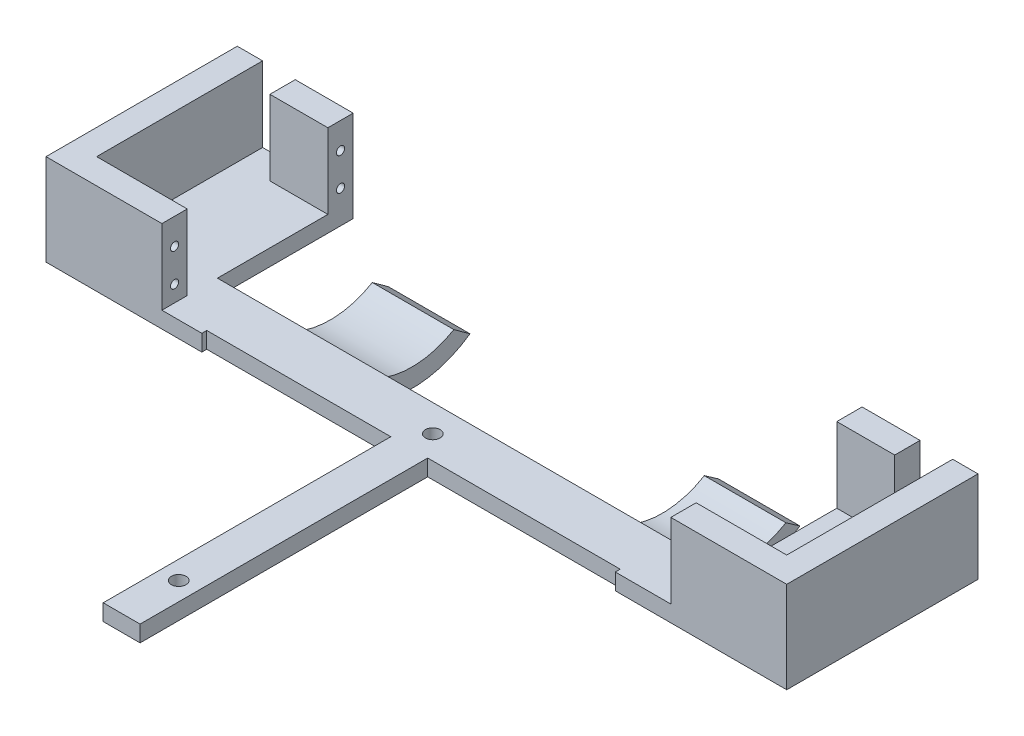
from build123d import *

# Parameters (mm, degrees)
BOSS_EXTRUDE1_DEPTH  = 5
SKETCH6_W            = 1.81
SKETCH6_H            = 7.76
SKETCH6_W_2          = 18.76
BOSS_EXTRUDE2_DEPTH  = 28
BOSS_EXTRUDE3_REACH  = 259.198
SKETCH7_W            = 7.76
SKETCH7_H            = 5
SKETCH9_W            = 27.76
SKETCH9_H            = 5
BOSS_EXTRUDE4_DEPTH  = 58.62
BOSS_EXTRUDE5_REACH  = 189.418
SKETCH10_W           = 27.76
SKETCH10_H           = 7.76
SKETCH11_W           = 58.62
SKETCH11_H           = 33
BOSS_EXTRUDE6_DEPTH  = 7.76
SKETCH12_R           = 2.25
CUT_EXTRUDE1_DEPTH   = 188.418175479
SKETCH13_W           = 1.81
SKETCH13_H           = 7.76
SKETCH13_W_2         = 18.76
BOSS_EXTRUDE7_DEPTH  = 28
BOSS_EXTRUDE8_REACH  = 265.563
SKETCH14_W           = 7.76
SKETCH14_H           = 5
SKETCH15_W           = 27.76
SKETCH15_H           = 5
BOSS_EXTRUDE9_DEPTH  = 50.86
BOSS_EXTRUDE10_REACH = 189.418
SKETCH16_W           = 27.76
SKETCH16_H           = 7.76
SKETCH17_W           = 58.62
SKETCH17_H           = 33
BOSS_EXTRUDE11_DEPTH = 7.76
CUT_EXTRUDE4_REACH   = 195.072
SKETCH23_W           = 35.52
SKETCH23_H           = 5
CUT_EXTRUDE5_REACH   = 195.072
SKETCH24_W           = 35.52
SKETCH24_H           = 5
SKETCH25_W           = 7.76
SKETCH25_H           = 23
CUT_EXTRUDE6_DEPTH   = 1.81
SKETCH26_W           = 7.76
SKETCH26_H           = 23
CUT_EXTRUDE7_DEPTH   = 1.81
SKETCH27_R           = 1.25
CUT_EXTRUDE8_DEPTH   = 5
CUT_EXTRUDE9_START   = -5
SKETCH28_R           = 1.25
CUT_EXTRUDE9_DEPTH   = 5
BOSS_EXTRUDE14_DEPTH = 25
SKETCH30_W           = 7.667684365
SKETCH30_H           = 9.552630881
CUT_EXTRUDE13_DEPTH  = 30
FILLET2_R            = 15
CUT_EXTRUDE14_REACH  = 193.616
SKETCH31_W           = 5
SKETCH31_H           = 41.6
FILLET6_R            = 21
BOSS_EXTRUDE15_DEPTH = 25
FILLET7_R            = 15
FILLET8_R            = 20
SKETCH37_W           = 7.377214054
SKETCH37_H           = 9
CUT_EXTRUDE16_DEPTH  = 25
CUT_EXTRUDE17_REACH  = 194.28
SKETCH38_W           = 1
SKETCH38_H           = 23
SKETCH39_W           = 12.24
SKETCH39_H           = 5
SKETCH39_W_2         = 12.01
CUT_EXTRUDE19_DEPTH  = 41.6


with BuildPart() as part:
    # Sketch5 → Boss-Extrude1 (new body)
    with BuildSketch(Plane(origin=(0, 0, 0), x_dir=(1, 0, 0), z_dir=(0, 1, 0))):
        Polygon((0, 0), (0, 88.14), (-56.41, 88.14), (-56.41, 86.64), (-96.41, 86.64), (-96.41, 145.26), (-56.41, 145.26), (-56.41, 103.66), (9.075, 103.66), (70.3, 103.66), (70.3, 145.26), (115.07, 145.26), (115.07, 86.64), (70.3, 86.64), (70.3, 88.14), (11.3, 88.14), (11.3, 0), align=None)
    extrude(amount=BOSS_EXTRUDE1_DEPTH)

    # Sketch6 → Boss-Extrude2 (add)
    with BuildSketch(Plane(origin=(0, 5, 0), x_dir=(1, 0, 0), z_dir=(0, 1, 0))):
        with Locations((-95.505, 141.38)):
            Rectangle(SKETCH6_W, SKETCH6_H)
        with Locations((-78.03, 141.38)):
            Rectangle(SKETCH6_W_2, SKETCH6_H)
    extrude(amount=BOSS_EXTRUDE2_DEPTH)

    # Sketch7 → Boss-Extrude3 (add, up to next)
    with BuildSketch(Plane(origin=(-94.6, 0, 0), x_dir=(0, 0, -1), z_dir=(1, 0, 0)), mode=Mode.PRIVATE) as boss_extrude3_sk1:
        with Locations((141.38, 30.5)):
            Rectangle(SKETCH7_W, SKETCH7_H)
    boss_extrude3_tool1 = extrude(boss_extrude3_sk1.sketch, amount=BOSS_EXTRUDE3_REACH, mode=Mode.PRIVATE) - part.part
    add(boss_extrude3_tool1.solids().sort_by_distance((-94.6, 30.5, -141.38))[0])

    # Sketch9 → Boss-Extrude4 (add)
    with BuildSketch(Plane(origin=(0, 0, -145.26), x_dir=(-1, 0, 0), z_dir=(0, 0, -1))):
        with Locations((82.53, 30.5)):
            Rectangle(SKETCH9_W, SKETCH9_H)
    extrude(amount=-BOSS_EXTRUDE4_DEPTH)

    # Sketch10 → Boss-Extrude5 (add, up to next)
    with BuildSketch(Plane.XZ.offset(-28), mode=Mode.PRIVATE) as boss_extrude5_sk1:
        with Locations((-82.53, -90.52)):
            Rectangle(SKETCH10_W, SKETCH10_H)
    boss_extrude5_tool1 = extrude(boss_extrude5_sk1.sketch, amount=BOSS_EXTRUDE5_REACH, mode=Mode.PRIVATE) - part.part
    add(boss_extrude5_tool1.solids().sort_by_distance((-82.53, 28, -90.52))[0])

    # Sketch11 → Boss-Extrude6 (add)
    with BuildSketch(Plane.ZY.offset(96.41)):
        with Locations((-115.95, 16.5)):
            Rectangle(SKETCH11_W, SKETCH11_H)
    extrude(amount=BOSS_EXTRUDE6_DEPTH)

    # Sketch12 → Cut-Extrude1 (cut, through all)
    with BuildSketch(Plane(origin=(0, 5, 0), x_dir=(1, 0, 0), z_dir=(0, 1, 0))):
        with Locations(Location((5.65, 17.48, 0), (0, 0, 270))):
            Circle(SKETCH12_R)
        with Locations(Location((5.65, 95.35, 0), (0, 0, 270))):
            Circle(SKETCH12_R)
    extrude(amount=-CUT_EXTRUDE1_DEPTH, mode=Mode.SUBTRACT)

    # Sketch13 → Boss-Extrude7 (add)
    with BuildSketch(Plane(origin=(0, 5, 0), x_dir=(1, 0, 0), z_dir=(0, 1, 0))):
        with Locations((114.165, 141.38)):
            Rectangle(SKETCH13_W, SKETCH13_H)
        with Locations((96.69, 141.38)):
            Rectangle(SKETCH13_W_2, SKETCH13_H)
    extrude(amount=BOSS_EXTRUDE7_DEPTH)

    # Sketch14 → Boss-Extrude8 (add, up to next)
    with BuildSketch(Plane.ZY.offset(-113.26), mode=Mode.PRIVATE) as boss_extrude8_sk1:
        with Locations((-141.38, 30.5)):
            Rectangle(SKETCH14_W, SKETCH14_H)
    boss_extrude8_tool1 = extrude(boss_extrude8_sk1.sketch, amount=BOSS_EXTRUDE8_REACH, mode=Mode.PRIVATE) - part.part
    add(boss_extrude8_tool1.solids().sort_by_distance((113.26, 30.5, -141.38))[0])

    # Sketch15 → Boss-Extrude9 (add)
    with BuildSketch(Plane.XY.offset(-137.5)):
        with Locations((101.19, 30.5)):
            Rectangle(SKETCH15_W, SKETCH15_H)
    extrude(amount=BOSS_EXTRUDE9_DEPTH)

    # Sketch16 → Boss-Extrude10 (add, up to next)
    with BuildSketch(Plane.XZ.offset(-28), mode=Mode.PRIVATE) as boss_extrude10_sk1:
        with Locations((101.19, -90.52)):
            Rectangle(SKETCH16_W, SKETCH16_H)
    boss_extrude10_tool1 = extrude(boss_extrude10_sk1.sketch, amount=BOSS_EXTRUDE10_REACH, mode=Mode.PRIVATE) - part.part
    add(boss_extrude10_tool1.solids().sort_by_distance((101.19, 28, -90.52))[0])

    # Sketch17 → Boss-Extrude11 (add)
    with BuildSketch(Plane(origin=(115.07, 0, 0), x_dir=(0, 0, -1), z_dir=(1, 0, 0))):
        with Locations((115.95, 16.5)):
            Rectangle(SKETCH17_W, SKETCH17_H)
    extrude(amount=BOSS_EXTRUDE11_DEPTH)

    # Sketch23 → Cut-Extrude4 (cut, up to next)
    with BuildSketch(Plane(origin=(0, 0, -145.26), x_dir=(-1, 0, 0), z_dir=(0, 0, -1)), mode=Mode.PRIVATE) as cut_extrude4_sk1:
        with Locations((-105.07, 30.5)):
            Rectangle(SKETCH23_W, SKETCH23_H)
    cut_extrude4_tool1 = extrude(cut_extrude4_sk1.sketch, amount=-CUT_EXTRUDE4_REACH, mode=Mode.PRIVATE) & part.part
    add(cut_extrude4_tool1.solids().sort_by_distance((105.07, 30.5, -145.26))[0], mode=Mode.SUBTRACT)

    # Sketch24 → Cut-Extrude5 (cut, up to next)
    with BuildSketch(Plane(origin=(0, 0, -145.26), x_dir=(-1, 0, 0), z_dir=(0, 0, -1)), mode=Mode.PRIVATE) as cut_extrude5_sk1:
        with Locations((86.41, 30.5)):
            Rectangle(SKETCH24_W, SKETCH24_H)
    cut_extrude5_tool1 = extrude(cut_extrude5_sk1.sketch, amount=-CUT_EXTRUDE5_REACH, mode=Mode.PRIVATE) & part.part
    add(cut_extrude5_tool1.solids().sort_by_distance((-86.41, 30.5, -145.26))[0], mode=Mode.SUBTRACT)

    # Sketch25 → Cut-Extrude6 (cut)
    with BuildSketch(Plane(origin=(-94.6, 0, 0), x_dir=(0, 0, -1), z_dir=(1, 0, 0))):
        with Locations((141.38, 16.5)):
            Rectangle(SKETCH25_W, SKETCH25_H)
    extrude(amount=-CUT_EXTRUDE6_DEPTH, mode=Mode.SUBTRACT)

    # Sketch26 → Cut-Extrude7 (cut)
    with BuildSketch(Plane.ZY.offset(-113.26)):
        with Locations((-141.38, 16.5)):
            Rectangle(SKETCH26_W, SKETCH26_H)
    extrude(amount=-CUT_EXTRUDE7_DEPTH, mode=Mode.SUBTRACT)

    # Sketch27 → Cut-Extrude8 (cut)
    with BuildSketch(Plane(origin=(-68.65, 0, 0), x_dir=(0, 0, -1), z_dir=(1, 0, 0))):
        with Locations((141.38, 10)):
            Circle(SKETCH27_R)
        with Locations((141.38, 20)):
            Circle(SKETCH27_R)
        with Locations((90.52, 10)):
            Circle(SKETCH27_R)
        with Locations((90.52, 20)):
            Circle(SKETCH27_R)
    extrude(amount=-CUT_EXTRUDE8_DEPTH, mode=Mode.SUBTRACT)

    # Sketch28 → Cut-Extrude9 (cut)
    with BuildSketch(Plane.ZY.offset(-87.31).offset(CUT_EXTRUDE9_START)):
        with Locations(Location((-90.52, 10, 0), (0, 0, 180))):
            Circle(SKETCH28_R)
        with Locations(Location((-90.52, 20, 0), (0, 0, 180))):
            Circle(SKETCH28_R)
        with Locations(Location((-141.38, 10, 0), (0, 0, 180))):
            Circle(SKETCH28_R)
        with Locations(Location((-141.38, 20, 0), (0, 0, 180))):
            Circle(SKETCH28_R)
    extrude(amount=CUT_EXTRUDE9_DEPTH, mode=Mode.SUBTRACT)

    # Sketch29 → Boss-Extrude14 (add)
    with BuildSketch(Plane.ZY.offset(-70.3)):
        with BuildLine():
            Line((-100.885806154, 13.5), (-96.02, 13.5))
            ThreePointArc((-96.02, 13.5), (-112.167541603, -13.110324995), (-143.227293091, -11.074561329))
            Line((-143.227293091, -11.074561329), (-138.921656543, -8.070233163))
            ThreePointArc((-138.921656543, -8.070233163), (-113.621311283, -8.363216103), (-100.885806154, 13.5))
        make_face()
    extrude(amount=BOSS_EXTRUDE14_DEPTH)

    # Sketch30 → Cut-Extrude13 (cut)
    with BuildSketch(Plane.ZY.offset(-45.3)):
        with Locations((-98.532876856, 9.77631544)):
            Rectangle(SKETCH30_W, SKETCH30_H)
    extrude(amount=-CUT_EXTRUDE13_DEPTH, mode=Mode.SUBTRACT)

    # Fillet2
    # the kernel refuses this fillet: 15 mm, written as the material it adds along each edge
    with BuildSketch(Plane(origin=(45.3, 2.021406869, -103.66), x_dir=(0, 1, 0), z_dir=(1, 0, 0))) as fillet2_piece_1:
        with BuildLine():
            CenterArc((4.606944532, -14.911353785), FILLET2_R, 96.232125796, 36.460543552)
            Line((-5.564040014, -3.886333451), (-5.767459705, -3.665833045))
            ThreePointArc((-5.767459705, -3.665833045), (-3.085586749, -1.508552064), (-0.137007694, 0.266887414))
            Line((-0.137007694, 0.266887414), (0, 0.3))
            ThreePointArc((0, 0.3), (1.489296566, 0.3), (2.946026103, 0.298227076))
            Line((2.946026103, 0.298227076), (2.978593131, 0))
        make_face()
    extrude(amount=25)

    # Sketch31 → Cut-Extrude14 (cut, up to next)
    with BuildSketch(Plane(origin=(0, 5, 0), x_dir=(1, 0, 0), z_dir=(0, 1, 0)), mode=Mode.PRIVATE) as cut_extrude14_sk1:
        with Locations((72.8, 124.46)):
            Rectangle(SKETCH31_W, SKETCH31_H)
    cut_extrude14_tool1 = extrude(cut_extrude14_sk1.sketch, amount=-CUT_EXTRUDE14_REACH, mode=Mode.PRIVATE) & part.part
    add(cut_extrude14_tool1.solids().sort_by_distance((72.8, 5, -124.46))[0], mode=Mode.SUBTRACT)

    # Fillet6
    fillet6_edges = [part.edges().sort_by_distance(p)[0] for p in [
        (57.8, 0, -99.229143351),
    ]]
    fillet(fillet6_edges, radius=FILLET6_R)

    # Sketch35 → Boss-Extrude15 (add)
    with BuildSketch(Plane(origin=(-56.41, 0, 0), x_dir=(0, 0, -1), z_dir=(1, 0, 0))):
        with BuildLine():
            Line((100.859945263, 14), (95.147502284, 14))
            ThreePointArc((95.147502284, 14), (111.813431349, -13.409569906), (143.817650668, -11.226072741))
            Line((143.817650668, -11.226072741), (138.864061969, -7.634657993))
            ThreePointArc((138.864061969, -7.634657993), (113.572690006, -7.865333939), (100.859945263, 14))
        make_face()
    extrude(amount=BOSS_EXTRUDE15_DEPTH)

    # Fillet7
    # the kernel refuses this fillet: 15 mm, written as the material it adds along each edge
    with BuildSketch(Plane(origin=(-31.41, 2.464890362, -103.66), x_dir=(0, -0.8213043286229281, -0.5704903152422844), z_dir=(-1, 0, 0))) as fillet7_piece_1:
        with BuildLine():
            CenterArc((4.607787404, -14.871807742), FILLET7_R, 82.503946448, 33.982894416)
            Line((-2.082096519, -1.446255497), (-2.215894198, -1.177744452))
            ThreePointArc((-2.215894198, -1.177744452), (-1.212195354, -0.47673645), (-0.171147095, 0.246391299))
            Line((-0.171147095, 0.246391299), (-0.039137371, 0.297436155))
            ThreePointArc((-0.039137371, 0.297436155), (3.282327972, 0.515021615), (6.603793315, 0.297436155))
            Line((6.603793315, 0.297436155), (6.564655944, 0))
        make_face()
    extrude(amount=25)

    # Fillet8
    fillet8_edges = [part.edges().sort_by_distance(p)[0] for p in [
        (-43.91, 0, -98.504347814),
    ]]
    fillet(fillet8_edges, radius=FILLET8_R)

    # Sketch37 → Cut-Extrude16 (cut)
    with BuildSketch(Plane(origin=(-31.41, 0, 0), x_dir=(0, 0, -1), z_dir=(1, 0, 0))):
        with Locations((98.836109311, 9.5)):
            Rectangle(SKETCH37_W, SKETCH37_H)
    extrude(amount=-CUT_EXTRUDE16_DEPTH, mode=Mode.SUBTRACT)

    # Sketch38 → Cut-Extrude17 (cut, up to next)
    with BuildSketch(Plane(origin=(0, 0, -145.26), x_dir=(-1, 0, 0), z_dir=(0, 0, -1)), mode=Mode.PRIVATE) as cut_extrude17_sk1:
        with Locations((86.91, 16.5)):
            Rectangle(SKETCH38_W, SKETCH38_H)
    cut_extrude17_tool1 = extrude(cut_extrude17_sk1.sketch, amount=-CUT_EXTRUDE17_REACH, mode=Mode.PRIVATE) & part.part
    # Sketch38 → Cut-Extrude17 (cut, up to next)
    with BuildSketch(Plane(origin=(0, 0, -145.26), x_dir=(-1, 0, 0), z_dir=(0, 0, -1)), mode=Mode.PRIVATE) as cut_extrude17_sk2:
        with Locations((-105.57, 16.5)):
            Rectangle(SKETCH38_W, SKETCH38_H)
    cut_extrude17_tool2 = extrude(cut_extrude17_sk2.sketch, amount=-CUT_EXTRUDE17_REACH, mode=Mode.PRIVATE) & part.part
    add(cut_extrude17_tool1.solids().sort_by_distance((-86.91, 16.5, -145.26))[0], mode=Mode.SUBTRACT)
    add(cut_extrude17_tool2.solids().sort_by_distance((105.57, 16.5, -145.26))[0], mode=Mode.SUBTRACT)

    # Sketch39 → Cut-Extrude19 (cut)
    with BuildSketch(Plane(origin=(0, 0, -145.26), x_dir=(-1, 0, 0), z_dir=(0, 0, -1))):
        with Locations((62.53, 2.5)):
            Rectangle(SKETCH39_W, SKETCH39_H)
        with Locations((-81.305, 2.5)):
            Rectangle(SKETCH39_W_2, SKETCH39_H)
    extrude(amount=-CUT_EXTRUDE19_DEPTH, mode=Mode.SUBTRACT)


solid = part.part
